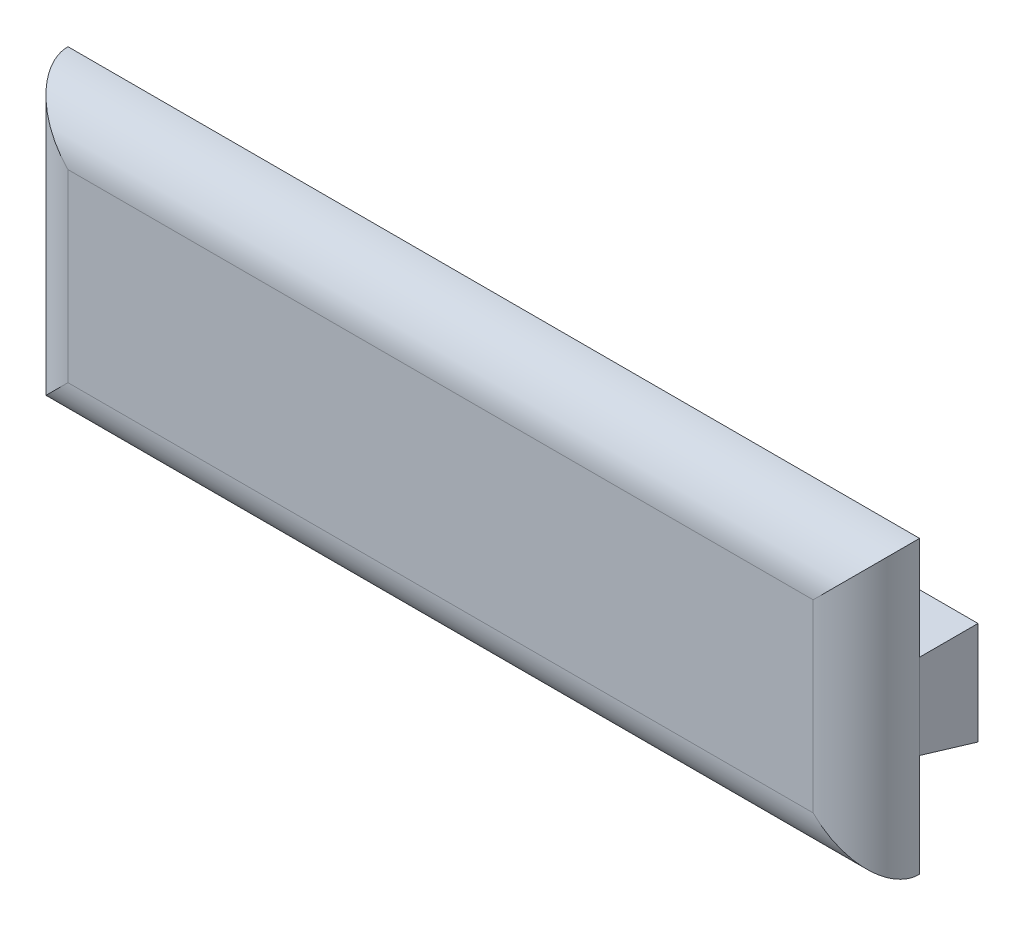
from build123d import *

# Parameters (mm, degrees)
SKETCH1_W           = 24
SKETCH1_H           = 8.2
BOSS_EXTRUDE1_DEPTH = 1.5
SKETCH2_W           = 24
SKETCH2_H           = 2.4
BOSS_EXTRUDE2_DEPTH = 1.4
BOSS_EXTRUDE2_DRAFT = -10
FILLET1_R           = 1.5


with BuildPart() as part:
    # Sketch1 → Boss-Extrude1 (new body)
    with BuildSketch(Plane.XY):
        Rectangle(SKETCH1_W, SKETCH1_H)
    extrude(amount=BOSS_EXTRUDE1_DEPTH)


with BuildPart() as boss_extrude2_tool:
    # Sketch2 → Boss-Extrude2 (with draft: the straight prism first)
    with BuildSketch(Plane(origin=(0, 0, 0), x_dir=(-1, 0, 0), z_dir=(0, 0, -1))):
        Rectangle(SKETCH2_W, SKETCH2_H)
    extrude(amount=BOSS_EXTRUDE2_DEPTH)
    # Boss-Extrude2: the draft: its side faces are tilted about the plane it starts from
    boss_extrude2_sides = [boss_extrude2_tool.faces().sort_by_distance(p)[0] for p in [
        (12, 0, -0.7),
        (0, -1.2, -0.7),
        (-12, 0, -0.7),
        (0, 1.2, -0.7),
    ]]
    draft(boss_extrude2_sides, Plane(origin=(0, 0, 0), x_dir=(-1, 0, 0), z_dir=(0, 0, -1)), BOSS_EXTRUDE2_DRAFT)


with BuildPart() as part_1:
    add(part.part)

    # Boss-Extrude2: add boss_extrude2_tool
    add(boss_extrude2_tool.part)

    # Fillet1
    fillet1_edges = [part_1.edges().sort_by_distance(p)[0] for p in [
        (0, -4.1, 1.5),
        (-12, 0, 1.5),
        (0, 4.1, 1.5),
        (12, 0, 1.5),
    ]]
    fillet(fillet1_edges, radius=FILLET1_R - 0.0001)  # a hair under: the kernel refuses the full size


solid = part_1.part
